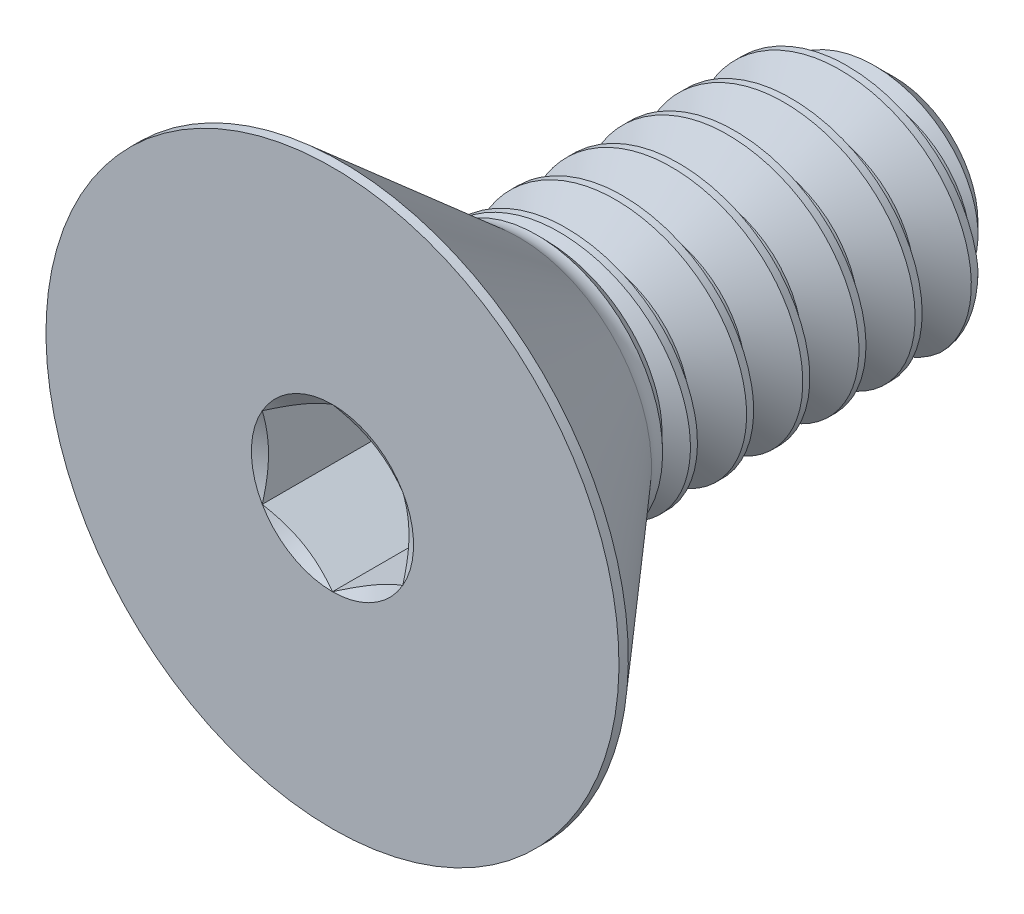
from build123d import *

# Parameters (mm, degrees)
SKETCH1_W          = 6.35
SKETCH1_H          = 1.4224
CHAMFER1_SIZE      = 0.47625
CUT_SWEEP1_PITCH   = 0.635
CUT_EXTRUDE2_DEPTH = 1.47574


with BuildPart() as part:
    # Sketch1 → Revolve1 (revolve)
    with BuildSketch(Plane(origin=(0, 0, 0), x_dir=(0, 0, -1), z_dir=(1, 0, 0))):
        with Locations((3.175, 0.7112)):
            Rectangle(SKETCH1_W, SKETCH1_H)
    revolve(axis=Axis((0, 0, -6.35), (0, 0, 1)))

    # Chamfer1
    chamfer1_edges = [part.edges().sort_by_distance(p)[0] for p in [
        (0, -1.4224, -6.35),
    ]]
    chamfer(chamfer1_edges, length=CHAMFER1_SIZE)

    # Cut-Sweep1: the profile of Sketch2 profile screwed along a right-hand helix of 10 turns, 6 arcs to a turn; built about Z, then put on its axis
    cut_sweep1_z = Axis((0, 0, 0), (0, 0, 1))
    cut_sweep1_corners = [(1.4227, 0, 0.000173205), (1.4227, 0, -0.555798205), (1.009955401, 0, -0.3175), (1.009955401, 0, -0.238125)]
    with BuildLine(mode=Mode.PRIVATE) as cut_sweep1_profile:
        Line(cut_sweep1_corners[0], cut_sweep1_corners[1])
        Line(cut_sweep1_corners[1], cut_sweep1_corners[2])
        Line(cut_sweep1_corners[2], cut_sweep1_corners[3])
        Line(cut_sweep1_corners[3], cut_sweep1_corners[0])
    cut_sweep1_cap = Face(cut_sweep1_profile.wire())
    cut_sweep1_turn_angles = [0, 30, 60, 90, 120, 150, 180, 210, 240, 270, 300, 330, 360]
    cut_sweep1_turn_weights = [1, 0.8660254037844387, 1, 0.8660254037844387, 1, 0.8660254037844387, 1, 0.8660254037844387, 1, 0.8660254037844387, 1, 0.8660254037844387, 1]
    cut_sweep1_turn_rails = [Edge.make_bspline([Vector(p[0], p[1], 0).rotate(cut_sweep1_z, cut_sweep1_turn_angles[k]) / cut_sweep1_turn_weights[k] + Vector(0, 0, p[2] + CUT_SWEEP1_PITCH * cut_sweep1_turn_angles[k] / 360) for k in range(13)], [0, 0, 0, 1, 1, 2, 2, 3, 3, 4, 4, 5, 5, 6, 6, 6], 2, cut_sweep1_turn_weights) for p in cut_sweep1_corners]
    cut_sweep1_turn_sides = [Face.make_surface_from_curves(cut_sweep1_turn_rails[p[0]], cut_sweep1_turn_rails[p[1]]) for p in [(0, 1), (1, 2), (2, 3), (3, 0)]]
    cut_sweep1 = Plane(origin=(0, 0, -6.35), x_dir=(0, 1, 0), z_dir=(0, 0, 1)) * Solid(Shell([*[p.moved(Location((0, 0, CUT_SWEEP1_PITCH * i))) for i in range(10) for p in cut_sweep1_turn_sides], cut_sweep1_cap, cut_sweep1_cap.rotate(cut_sweep1_z, 3600).moved(Location((0, 0, CUT_SWEEP1_PITCH * 3600 / 360)))]))
    add(cut_sweep1, mode=Mode.SUBTRACT)

    # Sketch7 → Revolve2 (revolve)
    with BuildSketch(Plane(origin=(0, 0, 0), x_dir=(0, 0, -1), z_dir=(1, 0, 0)), mode=Mode.PRIVATE) as revolve2_sk:
        with BuildLine():
            Line((0, 3.2385), (0.10541, 3.2385))
            Line((0.10541, 3.2385), (2.1082, 1.497501214))
            ThreePointArc((2.1082, 1.497501214), (2.201843405, 1.441789243), (2.309067322, 1.4224))
            Line((2.309067322, 1.4224), (2.309067322, 0))
            Line((2.309067322, 0), (0, 0))
            Line((0, 0), (0, 3.2385))
        make_face()
    revolve(revolve2_sk.sketch.rotate(Axis((0, 0, 0), (0, 0, -1)), 189.336081704), axis=Axis((0, 0, 0), (0, 0, -1)))

    # Boss-Extrude1 cone 1 section (through the dimple's axis) → Boss-Extrude1 (revolve)
    with BuildSketch(Plane(origin=(0, 0, -2.309067322), x_dir=(0, -1, 0), z_dir=(1, 0, 0))):
        Polygon((0, 0), (1.4224, 0), (0, 1.373595713), align=None)
    revolve(axis=Axis((0, 0, -2.309067322), (0, 0, -1)))

    # Sketch5 → Cut-Extrude2 (cut)
    with BuildSketch(Plane.XY):
        Polygon((0, 0.916543552), (-0.79375, 0.458271776), (-0.79375, -0.458271776), (0, -0.916543552), (0.79375, -0.458271776), (0.79375, 0.458271776), align=None)
    extrude(amount=-CUT_EXTRUDE2_DEPTH, mode=Mode.SUBTRACT)

    # Cut-Extrude3 cone 1 section (through the dimple's axis) → Cut-Extrude3 (revolve, cut)
    with BuildSketch(Plane(origin=(0, 0, 0), x_dir=(0, -1, 0), z_dir=(1, 0, 0))):
        Polygon((0, 0), (0.916543552, 0), (0, 0.529166667), align=None)
    revolve(axis=Axis((0, 0, 0), (0, 0, -1)), mode=Mode.SUBTRACT)


solid = part.part
